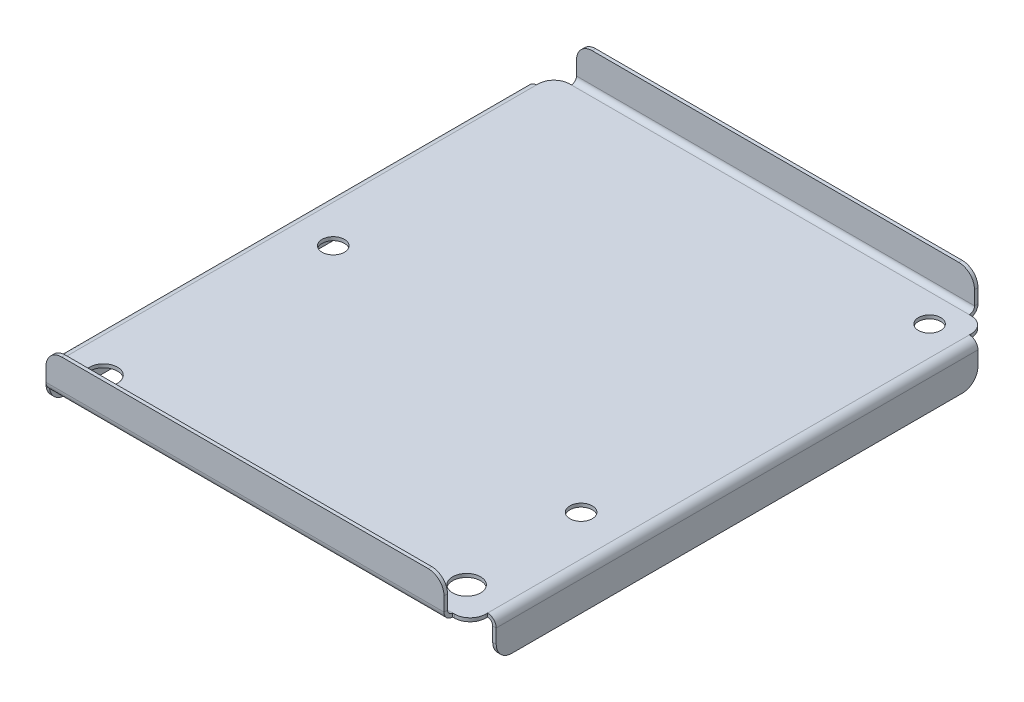
from build123d import *

# Parameters (mm, degrees)
SKETCH2_W               = 62
SKETCH2_H               = 74
BASE_FLANGE1_DEPTH      = 0.5
CUT_EXTRUDE1_REACH      = 50.273
SKETCH5_R               = 2
SKETCH5_R_2             = 1.6
EDGE_FLANGE1_DEPTH      = 57
EDGE_FLANGE1_BEND_DEPTH = 57
EDGE_FLANGE2_DEPTH      = 69
EDGE_FLANGE2_BEND_DEPTH = 69
BREAK_CORNER1_START     = -32.2366
BREAK_CORNER1_DEPTH     = 64.4732
BREAK_CORNER1_START_2   = -38.2366
BREAK_CORNER1_2_DEPTH   = 76.4732
BREAK_CORNER1_START_3   = -0.5
BREAK_CORNER1_3_DEPTH   = 0.5


# Read off the part's stored shape, not the designer's step: Break-Corner1
# Sheet-metal steps are written as plain solids
with BuildPart() as part:
    # Sketch2 → Base-Flange1 (new body)
    with BuildSketch(Plane(origin=(0, 0, 0), x_dir=(1, 0, 0), z_dir=(0, 1, 0))):
        Rectangle(SKETCH2_W, SKETCH2_H)
    extrude(amount=-BASE_FLANGE1_DEPTH)

    # Sketch5 → Cut-Extrude1 (cut, up to next)
    with BuildSketch(Plane(origin=(0, 0, 0), x_dir=(1, 0, 0), z_dir=(0, 1, 0)), mode=Mode.PRIVATE) as cut_extrude1_sk1:
        with Locations(Location((-26, -32.5, 0), (0, 0, 270))):
            Circle(SKETCH5_R)
    cut_extrude1_tool1 = extrude(cut_extrude1_sk1.sketch, amount=-CUT_EXTRUDE1_REACH, mode=Mode.PRIVATE) & part.part
    # Sketch5 → Cut-Extrude1 (cut, up to next)
    with BuildSketch(Plane(origin=(0, 0, 0), x_dir=(1, 0, 0), z_dir=(0, 1, 0)), mode=Mode.PRIVATE) as cut_extrude1_sk2:
        with Locations(Location((25.2, -15.3, 0), (0, 0, 270))):
            Circle(SKETCH5_R_2)
    cut_extrude1_tool2 = extrude(cut_extrude1_sk2.sketch, amount=-CUT_EXTRUDE1_REACH, mode=Mode.PRIVATE) & part.part
    # Sketch5 → Cut-Extrude1 (cut, up to next)
    with BuildSketch(Plane(origin=(0, 0, 0), x_dir=(1, 0, 0), z_dir=(0, 1, 0)), mode=Mode.PRIVATE) as cut_extrude1_sk3:
        with Locations(Location((-25.6, 0, 0), (0, 0, 270))):
            Circle(SKETCH5_R_2)
    cut_extrude1_tool3 = extrude(cut_extrude1_sk3.sketch, amount=-CUT_EXTRUDE1_REACH, mode=Mode.PRIVATE) & part.part
    # Sketch5 → Cut-Extrude1 (cut, up to next)
    with BuildSketch(Plane(origin=(0, 0, 0), x_dir=(1, 0, 0), z_dir=(0, 1, 0)), mode=Mode.PRIVATE) as cut_extrude1_sk4:
        with Locations(Location((26.8, 33, 0), (0, 0, 270))):
            Circle(SKETCH5_R_2)
    cut_extrude1_tool4 = extrude(cut_extrude1_sk4.sketch, amount=-CUT_EXTRUDE1_REACH, mode=Mode.PRIVATE) & part.part
    # Sketch5 → Cut-Extrude1 (cut, up to next)
    with BuildSketch(Plane(origin=(0, 0, 0), x_dir=(1, 0, 0), z_dir=(0, 1, 0)), mode=Mode.PRIVATE) as cut_extrude1_sk5:
        with Locations(Location((26, -32.5, 0), (0, 0, 270))):
            Circle(SKETCH5_R)
    cut_extrude1_tool5 = extrude(cut_extrude1_sk5.sketch, amount=-CUT_EXTRUDE1_REACH, mode=Mode.PRIVATE) & part.part
    add(cut_extrude1_tool1.solids().sort_by_distance((-26, 0, 32.5))[0], mode=Mode.SUBTRACT)
    add(cut_extrude1_tool2.solids().sort_by_distance((25.2, 0, 15.3))[0], mode=Mode.SUBTRACT)
    add(cut_extrude1_tool3.solids().sort_by_distance((-25.6, 0, 0))[0], mode=Mode.SUBTRACT)
    add(cut_extrude1_tool4.solids().sort_by_distance((26.8, 0, -33))[0], mode=Mode.SUBTRACT)
    add(cut_extrude1_tool5.solids().sort_by_distance((26, 0, 32.5))[0], mode=Mode.SUBTRACT)

    # Edge-Flange1 section (across the edge) → Edge-Flange1 (add)
    with BuildSketch(Plane(origin=(28.5, 0, -37.7366), x_dir=(0, 0, 1), z_dir=(-1, 0, 0))):
        with BuildLine():
            Line((-0.5, 0.7366), (-0.5, 5))
            Line((-0.5, 5), (0, 5))
            Line((0, 5), (0, 0.7366))
            ThreePointArc((0, 0.7366), (0.215745145, 0.215745145), (0.7366, 0))
            Line((0.7366, 0), (0.7366, -0.5))
            ThreePointArc((0.7366, -0.5), (-0.137808246, -0.137808246), (-0.5, 0.7366))
        make_face()
    extrude(amount=EDGE_FLANGE1_DEPTH)

    # Edge-Flange1 section 2 (across the edge) → Edge-Flange1 bend (add)
    with BuildSketch(Plane(origin=(-28.5, 0, 37.7366), x_dir=(0, 0, -1), z_dir=(1, 0, 0))):
        with BuildLine():
            Line((-0.5, 0.7366), (-0.5, 5))
            Line((-0.5, 5), (0, 5))
            Line((0, 5), (0, 0.7366))
            ThreePointArc((0, 0.7366), (0.215745145, 0.215745145), (0.7366, 0))
            Line((0.7366, 0), (0.7366, -0.5))
            ThreePointArc((0.7366, -0.5), (-0.137808246, -0.137808246), (-0.5, 0.7366))
        make_face()
    extrude(amount=EDGE_FLANGE1_BEND_DEPTH)

    # Edge-Flange2 section (across the edge) → Edge-Flange2 (add)
    with BuildSketch(Plane(origin=(31.7366, -0.5, -34.5), x_dir=(-1, 0, 0), z_dir=(0, 0, 1))):
        with BuildLine():
            Line((-0.5, 0.7366), (-0.5, 5))
            Line((-0.5, 5), (0, 5))
            Line((0, 5), (0, 0.7366))
            ThreePointArc((0, 0.7366), (0.215745145, 0.215745145), (0.7366, 0))
            Line((0.7366, 0), (0.7366, -0.5))
            ThreePointArc((0.7366, -0.5), (-0.137808246, -0.137808246), (-0.5, 0.7366))
        make_face()
    extrude(amount=EDGE_FLANGE2_DEPTH)

    # Edge-Flange2 section 2 (across the edge) → Edge-Flange2 bend (add)
    with BuildSketch(Plane(origin=(-31.7366, -0.5, 34.5), x_dir=(1, 0, 0), z_dir=(0, 0, -1))):
        with BuildLine():
            Line((-0.5, 0.7366), (-0.5, 5))
            Line((-0.5, 5), (0, 5))
            Line((0, 5), (0, 0.7366))
            ThreePointArc((0, 0.7366), (0.215745145, 0.215745145), (0.7366, 0))
            Line((0.7366, 0), (0.7366, -0.5))
            ThreePointArc((0.7366, -0.5), (-0.137808246, -0.137808246), (-0.5, 0.7366))
        make_face()
    extrude(amount=EDGE_FLANGE2_BEND_DEPTH)

    # Break-Corner1 outline → Break-Corner1 (cut)
    with BuildSketch(Plane.YZ.offset(BREAK_CORNER1_START)):
        with BuildLine():
            Line((-5.5, 34.5), (-5.5, 32.25))
            ThreePointArc((-5.5, 32.25), (-4.840990258, 33.840990258), (-3.25, 34.5))
            Line((-3.25, 34.5), (-5.5, 34.5))
        make_face()
        with BuildLine():
            ThreePointArc((-3.25, -34.5), (-4.840990258, -33.840990258), (-5.5, -32.25))
            Line((-5.5, -32.25), (-5.5, -34.5))
            Line((-5.5, -34.5), (-3.25, -34.5))
        make_face()
    extrude(amount=BREAK_CORNER1_DEPTH, mode=Mode.SUBTRACT)

    # Break-Corner1 2 outline → Break-Corner1 2 (cut)
    with BuildSketch(Plane.XY.offset(BREAK_CORNER1_START_2)):
        with BuildLine():
            ThreePointArc((-28.5, 2.75), (-27.840990258, 4.340990258), (-26.25, 5))
            Line((-26.25, 5), (-28.5, 5))
            Line((-28.5, 5), (-28.5, 2.75))
        make_face()
        with BuildLine():
            ThreePointArc((26.25, 5), (27.840990258, 4.340990258), (28.5, 2.75))
            Line((28.5, 2.75), (28.5, 5))
            Line((28.5, 5), (26.25, 5))
        make_face()
    extrude(amount=BREAK_CORNER1_2_DEPTH, mode=Mode.SUBTRACT)

    # Break-Corner1 3 outline → Break-Corner1 3 (cut)
    with BuildSketch(Plane(origin=(0, 0, 0), x_dir=(1, 0, 0), z_dir=(0, 1, 0)).offset(BREAK_CORNER1_START_3)):
        with BuildLine():
            ThreePointArc((-28.75, -37), (-30.340990258, -36.340990258), (-31, -34.75))
            Line((-31, -34.75), (-31, -37))
            Line((-31, -37), (-28.75, -37))
        make_face()
        with BuildLine():
            ThreePointArc((-31, 34.75), (-30.340990258, 36.340990258), (-28.75, 37))
            Line((-28.75, 37), (-31, 37))
            Line((-31, 37), (-31, 34.75))
        make_face()
        with BuildLine():
            ThreePointArc((28.75, 37), (30.340990258, 36.340990258), (31, 34.75))
            Line((31, 34.75), (31, 37))
            Line((31, 37), (28.75, 37))
        make_face()
        with BuildLine():
            ThreePointArc((31, -34.75), (30.340990258, -36.340990258), (28.75, -37))
            Line((28.75, -37), (31, -37))
            Line((31, -37), (31, -34.75))
        make_face()
    extrude(amount=BREAK_CORNER1_3_DEPTH, mode=Mode.SUBTRACT)


solid = part.part
